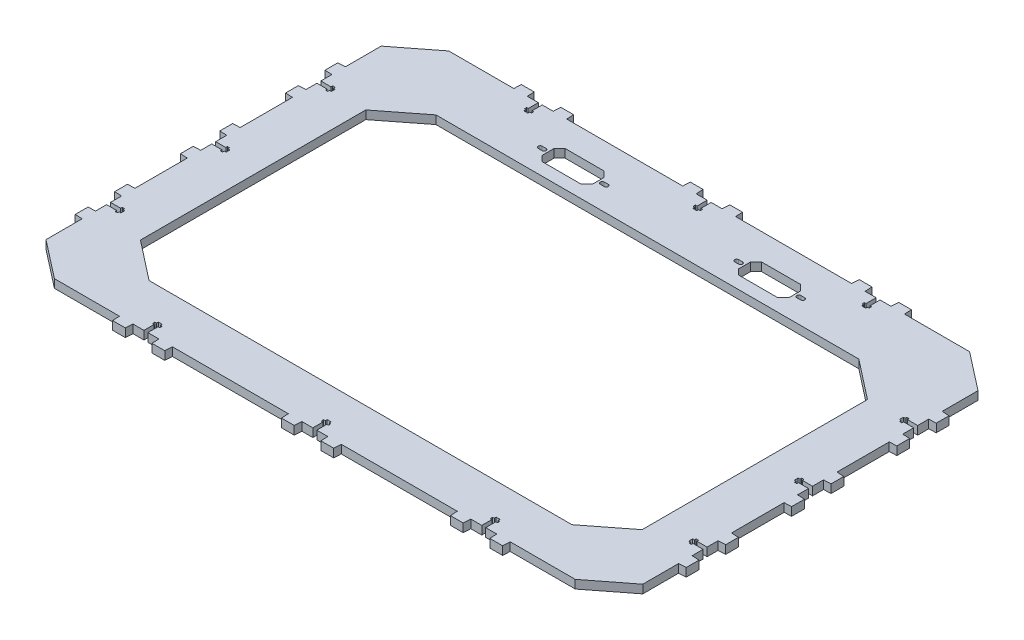
from build123d import *

# Parameters (mm, degrees)
BOSS_EXTRUDE1_DEPTH  = 6.4
CUT_EXTRUDE1_DEPTH   = 5
SKETCH3_R            = 5
SKETCH3_R_2          = 1.5
CUT_EXTRUDE3_DEPTH   = 5
BOSS_EXTRUDE2_DEPTH  = 5
SKETCH5_R            = 5
SKETCH5_R_2          = 1.5
SKETCH5_R_3          = 1.724165623
SKETCH5_R_4          = 1.459302327
BOSS_EXTRUDE3_DEPTH  = 5
SKETCH6_R            = 2.461200439
BOSS_EXTRUDE4_DEPTH  = 5
SKETCH7_R            = 1.5
SKETCH7_R_2          = 5
CUT_EXTRUDE4_DEPTH   = 5
BOSS_EXTRUDE7_DEPTH  = 5
SKETCH15_R           = 1.5
SKETCH15_R_2         = 5
BOSS_EXTRUDE9_DEPTH  = 5
BOSS_EXTRUDE10_DEPTH = 5
CUT_EXTRUDE6_DEPTH   = 421.691392919
CUT_EXTRUDE7_DEPTH   = 421.691392919
CUT_EXTRUDE8_START   = -6.4
CUT_EXTRUDE8_DEPTH   = 6.4
BOSS_EXTRUDE11_DEPTH = 6.4
CUT_EXTRUDE9_DEPTH   = 421.691392919
CUT_EXTRUDE11_DEPTH  = 421.691392919


# Read off the part's stored shape, not the designer's step: Cut-Extrude8
with BuildPart() as part:
    # Sketch1 → Boss-Extrude1 (new body)
    with BuildSketch(Plane(origin=(0, 0, 0), x_dir=(1, 0, 0), z_dir=(0, 1, 0))):
        Polygon((-76.576286082, -244.725182882), (-72.001286082, -244.725182882), (-43.001286082, -244.725182882), (-42.726286082, -250.225182882), (-33.026286082, -250.225182882), (-32.751286082, -244.725182882), (-32.576286082, -244.725182882), (-24.376286082, -244.725182882), (-24.376286082, -237.025182882), (-25.626286082, -237.025182882), (-25.626286082, -235.225182882), (-24.376286082, -235.225182882), (-24.376286082, -233.825182882), (-21.374926909, -233.825182882), (-21.374926909, -235.225182882), (-20.126286082, -235.225182882), (-20.126286082, -237.025182882), (-21.374926909, -237.025182882), (-21.374926909, -244.725182882), (-13.176286082, -244.725182882), (-13.001286082, -244.725182882), (-12.726286082, -250.225182882), (-3.026286082, -250.225182882), (-2.751286082, -244.725182882), (85.498034331, -244.725182882), (85.773034331, -250.225182882), (95.473034331, -250.225182882), (95.748034331, -244.725182882), (95.923034331, -244.725182882), (104.123034331, -244.725182882), (104.123034331, -237.025182882), (102.873034331, -237.025182882), (102.873034331, -235.225182882), (104.123034331, -235.225182882), (104.123034331, -233.825182882), (107.124393504, -233.825182882), (107.124393504, -235.225182882), (108.373034331, -235.225182882), (108.373034331, -237.025182882), (107.124393504, -237.025182882), (107.124393504, -244.725182882), (115.323034331, -244.725182882), (115.498034331, -244.725182882), (115.773034331, -250.225182882), (125.473034331, -250.225182882), (125.748034331, -244.725182881), (213.998713918, -244.725182881), (214.273713918, -250.225182881), (223.973713918, -250.225182881), (224.248713918, -244.725182881), (224.423713918, -244.725182881), (232.622354744, -244.725182881), (232.622354744, -237.025182881), (231.373713918, -237.025182881), (231.373713918, -235.225182881), (232.622354744, -235.225182881), (232.622354744, -233.825182881), (235.623713918, -233.825182881), (235.623713918, -235.225182881), (236.873713918, -235.225182881), (236.873713918, -237.025182882), (235.623713918, -237.025182882), (235.623713918, -244.725182882), (243.823713918, -244.725182882), (243.998713918, -244.725182882), (244.273713918, -250.225182882), (253.973713918, -250.225182882), (254.248713915, -244.725182882), (292.623713918, -244.725182882), (303.723713918, -244.725182882), (332.623713918, -222.225182882), (332.623713918, -194.948823735), (338.123713939, -194.673823735), (338.123713939, -184.973823735), (332.623713939, -184.698823735), (332.623713939, -184.523823735), (332.623713939, -179.523823708), (332.623713939, -176.325182908), (324.923713939, -176.325182908), (324.923713939, -177.573823735), (323.123713939, -177.573823735), (323.123713939, -176.325182908), (321.723713939, -176.325182908), (321.723713939, -173.323823735), (323.123713939, -173.323823735), (323.123713939, -172.073823735), (324.923713939, -172.073823735), (324.923713939, -173.323823735), (332.623713939, -173.323823735), (332.623713939, -173.322464535), (332.623713939, -170.123823708), (332.623713939, -165.123823735), (332.623713918, -164.948823708), (338.123713918, -164.673823708), (338.123713918, -154.973823708), (332.623713918, -154.698823708), (332.623713918, -114.923823708), (332.623713918, -114.748823708), (338.123713918, -114.473823708), (338.123713918, -104.773823708), (332.623713918, -104.498823708), (332.623713918, -104.323823708), (332.623713918, -99.323823708), (332.623713918, -96.125182882), (324.923713918, -96.125182882), (324.923713918, -97.373823708), (323.123713918, -97.373823708), (323.123713918, -96.125182882), (321.723713918, -96.125182882), (321.723713918, -93.123823708), (323.123713918, -93.123823708), (323.123713918, -91.873823708), (324.923713918, -91.873823708), (324.923713918, -93.123823708), (332.623713918, -93.123823708), (332.623713918, -84.923823708), (332.623713918, -84.748823708), (338.123713918, -84.473823708), (338.123713918, -74.773823708), (332.623713918, -74.498823708), (332.623713918, -74.323823708), (332.623713918, -34.923823708), (332.623713918, -34.748823708), (338.123713918, -34.473823708), (338.123713918, -24.773823708), (332.623713918, -24.498823708), (332.623713918, -24.323823708), (332.623713918, -19.323823708), (332.623713918, -16.125182882), (324.923713918, -16.125182882), (324.923713918, -17.373823708), (323.123713918, -17.373823708), (323.123713918, -16.125182882), (321.723713918, -16.125182882), (321.723713918, -13.123823708), (323.123713918, -13.123823708), (323.123713918, -11.873823708), (324.923713918, -11.873823708), (324.923713918, -13.123823708), (332.623713918, -13.123823708), (332.623713918, -13.122464535), (332.623713918, -9.923823708), (332.623713918, -4.923823708), (332.623713939, -4.748823735), (338.123713939, -4.473823735), (338.123713939, 5.226176265), (332.623713918, 5.501176265), (332.623713918, 5.676176265), (332.623713918, 15.076176265), (332.623713918, 30.277535439), (332.623713918, 32.777535466), (303.739039282, 55.265603953), (296.623713918, 55.243749719), (254.248713915, 55.277535465), (253.973713918, 60.777535465), (244.273713918, 60.777535465), (243.998713918, 55.277535465), (243.823713918, 55.277535465), (235.623713918, 55.277535465), (235.623713918, 47.577535465), (236.873713918, 47.577535465), (236.873713918, 45.777535465), (235.623713918, 45.777535465), (235.623713918, 44.377535465), (232.622354744, 44.377535465), (232.622354744, 45.777535465), (231.373713918, 45.777535465), (231.373713918, 47.577535465), (232.622354744, 47.577535465), (232.622354744, 55.277535465), (224.423713918, 55.277535465), (224.248713918, 55.277535465), (223.973713918, 60.777535465), (214.273713918, 60.777535465), (213.998713918, 55.277535465), (125.748034331, 55.277535465), (125.473034331, 60.777535465), (115.773034331, 60.777535465), (115.498034331, 55.277535465), (115.323034331, 55.277535465), (107.124393504, 55.277535465), (107.124393504, 47.577535465), (108.373034331, 47.577535465), (108.373034331, 45.777535465), (107.124393504, 45.777535465), (107.124393504, 44.377535465), (104.123034331, 44.377535465), (104.123034331, 45.777535465), (102.873034331, 45.777535465), (102.873034331, 47.577535465), (104.123034331, 47.577535465), (104.123034331, 55.277535465), (95.923034331, 55.277535465), (95.748034331, 55.277535465), (95.473034331, 60.777535465), (85.773034331, 60.777535465), (85.498034331, 55.277535465), (-2.751286082, 55.277535465), (-3.026286082, 60.777535465), (-12.726286082, 60.777535465), (-13.001286082, 55.277535465), (-13.176286082, 55.277535465), (-21.374926909, 55.277535465), (-21.374926909, 47.577535465), (-20.126286082, 47.577535465), (-20.126286082, 45.777535466), (-21.374926909, 45.777535466), (-21.374926909, 44.377535466), (-24.376286082, 44.377535466), (-24.376286082, 45.777535466), (-25.626286082, 45.777535466), (-25.626286082, 47.577535466), (-24.376286082, 47.577535466), (-24.376286082, 55.277535466), (-32.576286082, 55.277535466), (-32.751286082, 55.277535466), (-33.026286082, 60.777535466), (-42.726286082, 60.777535466), (-43.001286082, 55.277535465), (-92.476286082, 55.277535465), (-121.376286082, 32.777535465), (-121.376286082, 30.277535465), (-121.376286082, 25.476176292), (-121.376286082, 15.076176292), (-121.376286082, 5.676176292), (-121.376286082, 5.501176292), (-126.876286083, 5.226176292), (-126.876286083, -4.473823708), (-121.376286083, -4.748823708), (-121.376286082, -4.923823708), (-121.376286082, -9.923823708), (-121.376286082, -13.122464535), (-121.376286082, -13.123823708), (-113.676286082, -13.123823708), (-113.676286082, -11.873823708), (-111.876286082, -11.873823708), (-111.876286082, -13.123823708), (-110.476286082, -13.123823708), (-110.476286082, -16.125182882), (-111.876286082, -16.125182882), (-111.876286082, -17.373823708), (-113.676286082, -17.373823708), (-113.676286082, -16.125182882), (-121.376286082, -16.125182882), (-121.376286082, -19.323823708), (-121.376286082, -24.323823708), (-121.376286082, -24.498823708), (-126.876286082, -24.773823708), (-126.876286082, -34.473823708), (-121.376286082, -34.748823708), (-121.376286082, -34.923823708), (-121.376286082, -74.323823708), (-121.376286082, -74.498823708), (-126.876286082, -74.773823708), (-126.876286082, -84.473823708), (-121.376286082, -84.748823708), (-121.376286082, -84.923823708), (-121.376286082, -89.923823708), (-121.376286082, -93.122464535), (-121.376286082, -93.123823708), (-113.676286082, -93.123823708), (-113.676286082, -91.873823708), (-111.876286082, -91.873823708), (-111.876286082, -93.123823708), (-110.476286082, -93.123823708), (-110.476286082, -96.125182882), (-111.876286082, -96.125182882), (-111.876286082, -97.373823708), (-113.676286082, -97.373823708), (-113.676286082, -96.125182882), (-121.376286082, -96.125182882), (-121.376286082, -99.323823708), (-121.376286082, -104.323823708), (-121.376286082, -104.498823708), (-126.876286082, -104.773823708), (-126.876286082, -114.473823708), (-121.376286082, -114.748823708), (-121.376286082, -114.923823708), (-121.376286082, -154.323823708), (-121.376286082, -154.498823708), (-126.876286082, -154.773823708), (-126.876286082, -164.473823708), (-121.376286082, -164.748823708), (-121.376286082, -164.923823708), (-121.376286082, -169.923823708), (-121.376286082, -173.122464535), (-121.376286082, -173.123823708), (-113.676286082, -173.123823708), (-113.676286082, -171.873823708), (-111.876286082, -171.873823708), (-111.876286082, -173.123823708), (-110.476286082, -173.123823708), (-110.476286082, -176.125182882), (-111.876286082, -176.125182882), (-111.876286082, -177.373823708), (-113.676286082, -177.373823708), (-113.676286082, -176.125182882), (-121.376286082, -176.125182882), (-121.376286082, -179.323823708), (-121.376286082, -184.323823708), (-121.376286083, -184.498823708), (-126.876286083, -184.773823708), (-126.876286083, -194.473823708), (-121.376286082, -194.748823708), (-121.376286082, -194.923823708), (-121.376286082, -204.725182882), (-121.376286082, -219.725182882), (-121.376286082, -222.225182882), (-92.476286082, -244.725182882), (-83.376286082, -244.725182882), (-83.376286082, -244.301005064), (-83.376286082, -242.725182882), (-83.376286082, -236.025182882), (-84.626286082, -236.025182882), (-84.626286082, -234.225182882), (-83.376286082, -234.225182882), (-83.376286082, -233.225182882), (-80.374926909, -233.225182882), (-80.374926909, -234.225182882), (-79.126286082, -234.225182882), (-79.126286082, -236.025182882), (-80.374926909, -236.025182882), (-80.374926909, -244.725182882), (-77.176286082, -244.725182882), align=None)
        with BuildLine():
            ThreePointArc((5.748713917, 25.077535465), (4.248713917, 26.577535465), (5.748713917, 28.077535465))
            Line((5.748713917, 28.077535465), (8.748713917, 28.077535465))
            ThreePointArc((8.748713917, 28.077535465), (10.248713917, 26.577535465), (8.748713917, 25.077535465))
            Line((8.748713917, 25.077535465), (5.748713917, 25.077535465))
        make_face(mode=Mode.SUBTRACT)
        Polygon((11.798713918, 22.084136225), (11.798713918, 31.070934706), (15.998713918, 35.270934706), (45.748713918, 35.270934706), (49.948713918, 31.070934706), (49.948713918, 22.084136225), (45.748713918, 17.884136225), (15.998713918, 17.884136225), align=None, mode=Mode.SUBTRACT)
        with BuildLine():
            ThreePointArc((55.998713918, 28.077535465), (57.498713918, 26.577535465), (55.998713918, 25.077535465))
            Line((55.998713918, 25.077535465), (52.998713918, 25.077535465))
            ThreePointArc((52.998713918, 25.077535465), (51.498713918, 26.577535465), (52.998713918, 28.077535465))
            Line((52.998713918, 28.077535465), (55.998713918, 28.077535465))
        make_face(mode=Mode.SUBTRACT)
        with BuildLine():
            Line((158.248713918, 25.077535465), (155.248713918, 25.077535465))
            ThreePointArc((155.248713918, 25.077535465), (153.748713918, 26.577535465), (155.248713918, 28.077535465))
            Line((155.248713918, 28.077535465), (158.248713918, 28.077535465))
            ThreePointArc((158.248713918, 28.077535465), (159.748713918, 26.577535465), (158.248713918, 25.077535465))
        make_face(mode=Mode.SUBTRACT)
        Polygon((199.448713918, 31.070934706), (199.448713918, 22.084136225), (195.248713918, 17.884136225), (165.498713918, 17.884136225), (161.298713918, 22.084136225), (161.298713918, 31.070934706), (165.498713918, 35.270934706), (195.248713918, 35.270934706), align=None, mode=Mode.SUBTRACT)
        with BuildLine():
            ThreePointArc((205.498713918, 28.077535465), (206.998713918, 26.577535465), (205.498713918, 25.077535465))
            Line((205.498713918, 25.077535465), (202.498713918, 25.077535465))
            ThreePointArc((202.498713918, 25.077535465), (200.998713918, 26.577535465), (202.498713918, 28.077535465))
            Line((202.498713918, 28.077535465), (205.498713918, 28.077535465))
        make_face(mode=Mode.SUBTRACT)
    extrude(amount=BOSS_EXTRUDE1_DEPTH)

    # Sketch2 → Cut-Extrude1 (cut)
    with BuildSketch(Plane(origin=(0, 6.4, 0), x_dir=(-1, 0, 0), z_dir=(0, 1, 0))):
        Polygon((-225.623713918, -10.276176292), (14.376286082, -10.276176292), (44.376286082, 19.923823708), (44.376286082, 169.923823708), (14.376286082, 199.723823708), (-225.623713918, 199.723823708), (-255.623713918, 169.923823708), (-255.623713918, 19.923823708), align=None)
    extrude(amount=-CUT_EXTRUDE1_DEPTH, mode=Mode.SUBTRACT)

    # Sketch3 → Cut-Extrude3 (cut)
    with BuildSketch(Plane(origin=(0, 6.4, 0), x_dir=(1, 0, 0), z_dir=(0, 1, 0))):
        with Locations((111.039075354, 42.666394912)):
            Circle(SKETCH3_R)
        with Locations(Location((120.505008914, 41.067613551, 0), (0, 0, 270))):
            Circle(SKETCH3_R_2)
        with Locations(Location((118.206324627, 36.279647865, 0), (0, 0, 270))):
            Circle(SKETCH3_R_2)
        with Locations(Location((-7.957537619, 36.279647865, 0), (0, 0, 270))):
            Circle(SKETCH3_R_2)
        with Locations(Location((-10.256221905, 41.067613551, 0), (0, 0, 270))):
            Circle(SKETCH3_R_2)
        with Locations(Location((-0.790288345, 42.666394912, 0), (0, 0, 270))):
            Circle(SKETCH3_R)
    extrude(amount=-CUT_EXTRUDE3_DEPTH, mode=Mode.SUBTRACT)

    # Sketch4 → Boss-Extrude2 (add)
    with BuildSketch(Plane(origin=(0, 6.4, 0), x_dir=(1, 0, 0), z_dir=(0, 1, 0))):
        Polygon((-44.376286082, -27.923823708), (-54.108785664, -37.65632329), (-54.108785664, -10.729220488), (-14.376286082, 17.582811301), (34.443778554, 14.453576308), (225.623713918, 14.453576308), (261.812413926, -21.7351237), (262.399043281, -34.699153071), (255.623713918, -27.923823708), (225.623713918, 2.076176292), (-14.376286082, 2.076176292), align=None)
    extrude(amount=-BOSS_EXTRUDE2_DEPTH)

    # Sketch5 → Boss-Extrude3 (add)
    with BuildSketch(Plane(origin=(0, 6.4, 0), x_dir=(1, 0, 0), z_dir=(0, 1, 0))):
        with Locations((-0.790288345, 42.666394912)):
            Circle(SKETCH5_R)
        with Locations((-10.256221905, 41.067613551)):
            Circle(SKETCH5_R_2)
        with Locations((-7.957537619, 36.279647865)):
            Circle(SKETCH5_R_3)
        with Locations((111.039075354, 42.666394912)):
            Circle(SKETCH5_R)
        with Locations((120.505008914, 41.067613551)):
            Circle(SKETCH5_R_2)
        with Locations(Location((118.206324627, 36.279647865, 0), (0, 0, 270))):
            Circle(SKETCH5_R_4)
    extrude(amount=-BOSS_EXTRUDE3_DEPTH)

    # Sketch6 → Boss-Extrude4 (add)
    with BuildSketch(Plane(origin=(0, 6.4, 0), x_dir=(1, 0, 0), z_dir=(0, 1, 0))):
        with Locations((118.206324627, 36.279647865)):
            Circle(SKETCH6_R)
    extrude(amount=-BOSS_EXTRUDE4_DEPTH)

    # Sketch7 → Cut-Extrude4 (cut)
    with BuildSketch(Plane(origin=(0, 6.4, 0), x_dir=(1, 0, 0), z_dir=(0, 1, 0))):
        with Locations(Location((138.123713918, 38.176176292, 0), (0, 0, 270))):
            Circle(SKETCH7_R)
        with Locations(Location((138.123713918, 18.976176292, 0), (0, 0, 270))):
            Circle(SKETCH7_R)
        with Locations(Location((138.123713918, 28.576176292, 0), (0, 0, 270))):
            Circle(SKETCH7_R_2)
        with Locations(Location((73.123713918, 28.576176292, 0), (0, 0, 270))):
            Circle(SKETCH7_R_2)
        with Locations(Location((73.123713918, 18.976176292, 0), (0, 0, 270))):
            Circle(SKETCH7_R)
        with Locations(Location((73.123713918, 38.176176292, 0), (0, 0, 270))):
            Circle(SKETCH7_R)
    extrude(amount=-CUT_EXTRUDE4_DEPTH, mode=Mode.SUBTRACT)

    # Sketch10 → Boss-Extrude7 (add)
    with BuildSketch(Plane(origin=(0, 6.4, 0), x_dir=(-1, 0, 0), z_dir=(0, 1, 0))):
        Polygon((51.376286082, 242.16516082), (48.940275325, 244.725182882), (51.989394439, 244.725182882), align=None)
    extrude(amount=-BOSS_EXTRUDE7_DEPTH)

    # Sketch15 → Boss-Extrude9 (add)
    with BuildSketch(Plane(origin=(0, 6.4, 0), x_dir=(1, 0, 0), z_dir=(0, 1, 0))):
        with Locations((138.123713918, 38.176176292)):
            Circle(SKETCH15_R)
        with Locations((138.123713918, 28.576176292)):
            Circle(SKETCH15_R_2)
        with Locations((138.123713918, 18.976176292)):
            Circle(SKETCH15_R)
        with Locations((73.123713918, 28.576176292)):
            Circle(SKETCH15_R_2)
        with Locations((73.123713918, 38.176176292)):
            Circle(SKETCH15_R)
        with Locations((73.123713918, 18.976176292)):
            Circle(SKETCH15_R)
    extrude(amount=-BOSS_EXTRUDE9_DEPTH)

    # Sketch16 → Boss-Extrude10 (add)
    with BuildSketch(Plane(origin=(0, 6.4, 0), x_dir=(1, 0, 0), z_dir=(0, 1, 0))):
        Polygon((-47.664002191, -19.923823708), (-14.167005742, 13.57317274), (224.566398493, 13.57317274), (258.063394941, -19.923823708), (254.245035971, -23.742182678), (224.566398493, 5.9364548), (-14.167005742, 5.9364548), (-44.376286082, -23.742182678), align=None)
    extrude(amount=-BOSS_EXTRUDE10_DEPTH)

    # Sketch20 → Cut-Extrude6 (cut, through all)
    with BuildSketch(Plane(origin=(0, 6.4, 0), x_dir=(-1, 0, 0), z_dir=(0, 1, 0))):
        Polygon((49.376286082, 24.722464535), (49.376286082, 174.723823708), (19.376286082, 204.723823708), (-230.623713918, 204.723823708), (-260.623713918, 174.723823708), (-260.623713918, 24.722464535), (-230.623713918, -5.277535465), (19.376286082, -5.277535465), align=None)
    extrude(amount=-CUT_EXTRUDE6_DEPTH, mode=Mode.SUBTRACT)

    # Sketch25 → Cut-Extrude7 (cut, through all)
    with BuildSketch(Plane(origin=(0, 6.4, 0), x_dir=(-1, 0, 0), z_dir=(0, 1, 0))):
        Polygon((19.376286082, -5.277535465), (29.376286082, -5.277535465), (59.376286082, 24.722464535), (59.376286082, 174.723823708), (29.376286082, 204.723823708), (19.376286082, 204.723823708), (49.376286082, 174.723823708), (49.376286082, 24.722464535), align=None)
        Polygon((-260.623713918, 174.723823708), (-230.623713918, 204.723823708), (-240.623713918, 204.723823708), (-270.623713918, 174.723823708), (-270.623713918, 24.722464535), (-240.623713918, -5.277535465), (-230.623713918, -5.277535465), (-260.623713918, 24.722464535), align=None)
    extrude(amount=-CUT_EXTRUDE7_DEPTH, mode=Mode.SUBTRACT)

    # Cut-Extrude8 outline → Cut-Extrude8 (cut)
    with BuildSketch(Plane(origin=(0, 6.4, 0), x_dir=(1, 0, 0), z_dir=(0, 1, 0)).offset(CUT_EXTRUDE8_START)):
        Polygon((-29.376286082, 8.277535465), (-59.376286082, -21.722464535), (-59.376286082, -24.722464535), (-29.376286082, 5.277535465), (240.623713918, 5.277535465), (270.623713918, -24.722464535), (270.623713918, -21.722464535), (240.623713918, 8.277535465), align=None)
    extrude(amount=CUT_EXTRUDE8_DEPTH, mode=Mode.SUBTRACT)

    # Sketch28 → Boss-Extrude11 (add)
    with BuildSketch(Plane.XZ):
        Polygon((-80.374926909, 244.725182882), (-83.376286082, 244.725182882), (-83.376286082, 236.025182882), (-84.626286082, 236.025182882), (-84.626286082, 234.225182882), (-83.376286082, 234.225182882), (-83.376286082, 233.225182882), (-80.374926909, 233.225182882), (-80.374926909, 234.225182882), (-79.126286082, 234.225182882), (-79.126286082, 236.025182882), (-80.374926909, 236.025182882), align=None)
    extrude(amount=-BOSS_EXTRUDE11_DEPTH)

    # Sketch29 → Cut-Extrude9 (cut, through all)
    with BuildSketch(Plane.XZ):
        Polygon((-21.374926909, -47.577535465), (-20.126286082, -47.577535465), (-20.126286082, -45.777535466), (-21.374926909, -45.777535466), (-21.374926909, -44.377535466), (-24.376286082, -44.377535466), (-24.376286082, -45.777535466), (-25.626286082, -45.777535466), (-25.626286082, -47.577535466), (-24.376286082, -47.577535466), (-24.376286082, -55.277535466), (-21.374926909, -55.277535465), align=None)
        Polygon((107.124393504, -47.577535465), (108.373034331, -47.577535465), (108.373034331, -45.777535465), (107.124393504, -45.777535465), (107.124393504, -44.377535465), (104.123034331, -44.377535465), (104.123034331, -45.777535465), (102.873034331, -45.777535465), (102.873034331, -47.577535466), align=None)
    extrude(amount=-CUT_EXTRUDE9_DEPTH, mode=Mode.SUBTRACT)

    # Sketch31 → Cut-Extrude11 (cut, through all)
    with BuildSketch(Plane(origin=(0, 6.4, 0), x_dir=(1, 0, 0), z_dir=(0, 1, 0))):
        Polygon((-29.376286082, -209.975182882), (240.623713918, -209.975182882), (266.473713918, -209.975182882), (296.432907193, -186.568495794), (296.432907193, -176.125182882), (296.432907193, -15.129151623), (266.473713918, 8.277535465), (240.623713918, 8.277535465), (-29.376286082, 8.277535465), (-51.376286082, 8.277535465), (-55.226286082, 8.277535465), (-85.185479358, -15.129151623), (-85.185479358, -186.568495794), (-55.226286082, -209.975182882), (-51.376286082, -209.975182882), align=None)
    extrude(amount=-CUT_EXTRUDE11_DEPTH, mode=Mode.SUBTRACT)


solid = part.part
